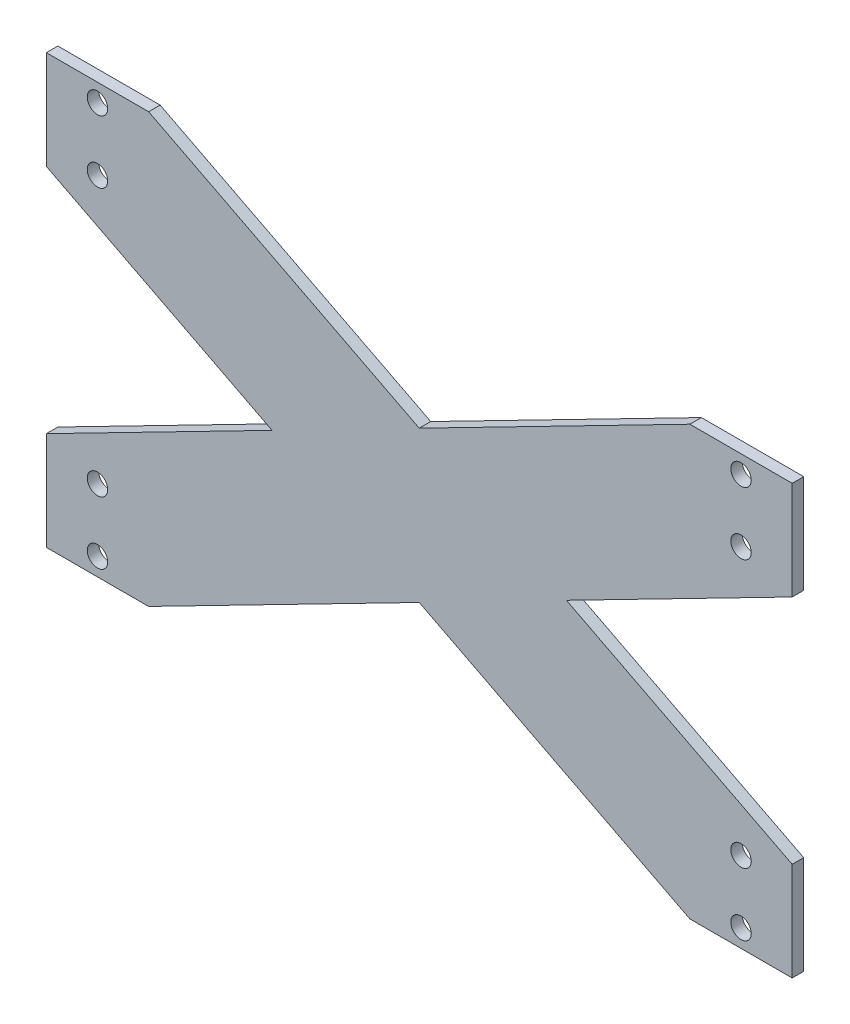
from build123d import *

# Parameters (mm, degrees)
SKETCH1_R           = 4
BOSS_EXTRUDE1_DEPTH = 4.5


with BuildPart() as part:
    # Sketch1 → Boss-Extrude1 (new body)
    with BuildSketch(Plane.XY):
        Polygon((6.342010442, 20.5), (6.342010442, -18), (94.597049202, -63.25), (6.342010442, -108.5), (6.342010442, -147), (46.342010442, -147), (152.142010442, -92.754372019), (257.942010442, -147), (297.942010442, -147), (297.942010442, -108.5), (209.686971683, -63.25), (297.942010442, -18), (297.942010442, 20.5), (257.942010442, 20.5), (152.142010442, -33.745627981), (46.342010442, 20.5), align=None)
        with Locations((26.342010442, -11)):
            Circle(SKETCH1_R, mode=Mode.SUBTRACT)
        with Locations((26.342010442, 13.5)):
            Circle(SKETCH1_R, mode=Mode.SUBTRACT)
        with Locations((26.342010442, -115.5)):
            Circle(SKETCH1_R, mode=Mode.SUBTRACT)
        with Locations((26.342010442, -140)):
            Circle(SKETCH1_R, mode=Mode.SUBTRACT)
        with Locations((277.942010442, 13.5)):
            Circle(SKETCH1_R, mode=Mode.SUBTRACT)
        with Locations((277.942010442, -11)):
            Circle(SKETCH1_R, mode=Mode.SUBTRACT)
        with Locations((277.942010442, -115.5)):
            Circle(SKETCH1_R, mode=Mode.SUBTRACT)
        with Locations((277.942010442, -140)):
            Circle(SKETCH1_R, mode=Mode.SUBTRACT)
    extrude(amount=BOSS_EXTRUDE1_DEPTH)


solid = part.part
